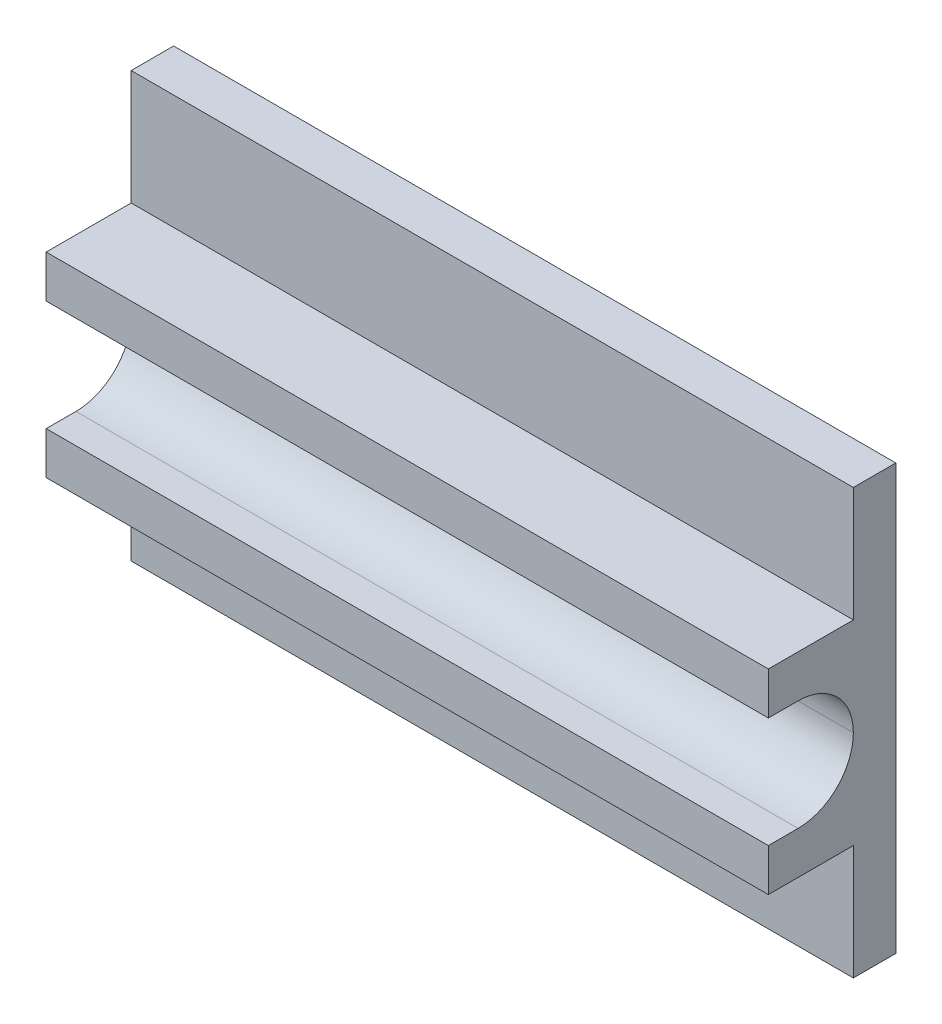
from build123d import *

# Parameters (mm, degrees)
SKIZZE1_W                       = 17
SKIZZE1_H                       = 10
AUFSATZ_LINEAR_AUSTRAGEN1_DEPTH = 1
SKIZZE2_W                       = 17
SKIZZE2_H                       = 1
AUFSATZ_LINEAR_AUSTRAGEN2_DEPTH = 2
VERRUNDUNG1_R                   = 1.3


with BuildPart() as part:
    # Skizze1 → Aufsatz-Linear austragen1 (new body)
    with BuildSketch(Plane.XY):
        with Locations((-1.5, 0)):
            Rectangle(SKIZZE1_W, SKIZZE1_H)
    extrude(amount=AUFSATZ_LINEAR_AUSTRAGEN1_DEPTH)

    # Skizze2 → Aufsatz-Linear austragen2 (add)
    with BuildSketch(Plane.XY.offset(1)):
        with Locations((-1.5, 1.8)):
            Rectangle(SKIZZE2_W, SKIZZE2_H)
        with Locations((-1.5, -1.8)):
            Rectangle(SKIZZE2_W, SKIZZE2_H)
    extrude(amount=AUFSATZ_LINEAR_AUSTRAGEN2_DEPTH)

    # Verrundung1
    verrundung1_edges = [part.edges().sort_by_distance(p)[0] for p in [
        (-1.5, -1.3, 1),
        (-1.5, 1.3, 1),
    ]]
    fillet(verrundung1_edges, radius=VERRUNDUNG1_R - 0.0001)  # a hair under: the kernel refuses the full size


solid = part.part
